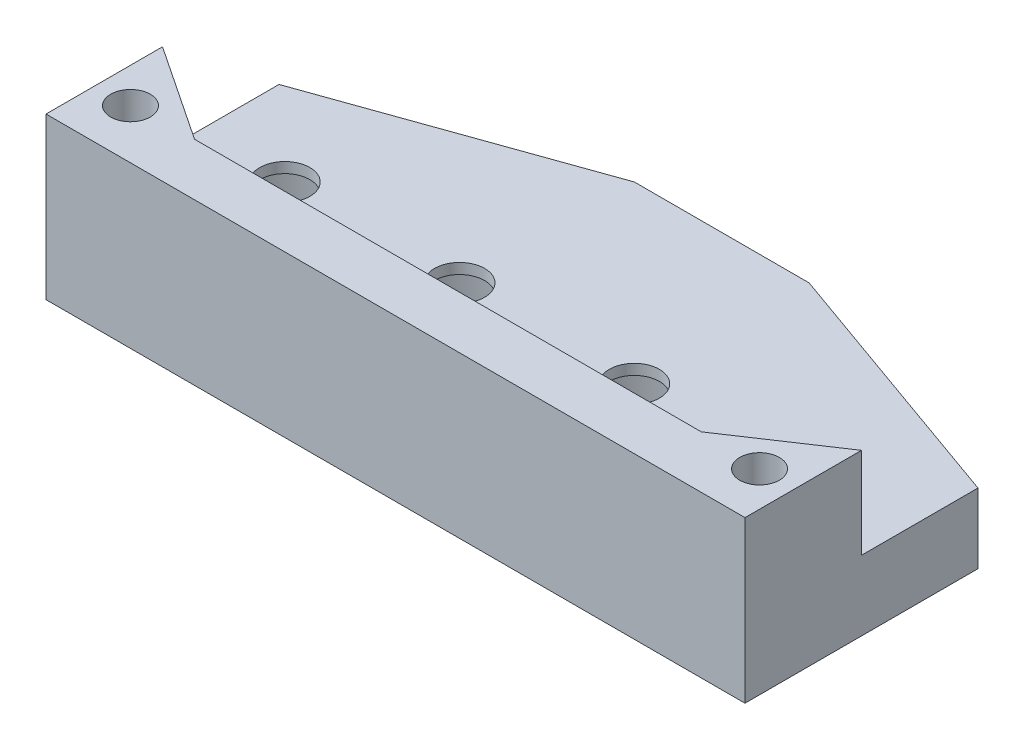
from build123d import *

# Parameters (mm, degrees)
SKETCH2_R           = 2.15
BOSS_EXTRUDE1_DEPTH = 6
BOSS_EXTRUDE2_DEPTH = 7.8
SKETCH4_R           = 1.7
CUT_EXTRUDE1_DEPTH  = 68.634606527
SKETCH5_R           = 6.55
CUT_EXTRUDE2_DEPTH  = 5.1


with BuildPart() as part:
    # Sketch2 → Boss-Extrude1 (new body)
    with BuildSketch(Plane(origin=(0, 0, 0), x_dir=(1, 0, 0), z_dir=(0, 1, 0))):
        Polygon((0, 0), (0, 20), (22.5, 28), (37.5, 28), (60, 20), (60, 0), align=None)
        with Locations((7.5, 13)):
            Circle(SKETCH2_R, mode=Mode.SUBTRACT)
        with Locations((22.5, 13)):
            Circle(SKETCH2_R, mode=Mode.SUBTRACT)
        with Locations((37.5, 13)):
            Circle(SKETCH2_R, mode=Mode.SUBTRACT)
        with Locations((52.5, 13)):
            Circle(SKETCH2_R, mode=Mode.SUBTRACT)
    extrude(amount=BOSS_EXTRUDE1_DEPTH)

    # Sketch3 → Boss-Extrude2 (add)
    with BuildSketch(Plane(origin=(0, 6, 0), x_dir=(1, 0, 0), z_dir=(0, 1, 0))):
        Polygon((0, 10), (0, 0), (60, 0), (60, 10), (51.75, 4.5), (8.25, 4.5), align=None)
    extrude(amount=BOSS_EXTRUDE2_DEPTH)

    # Sketch4 → Cut-Extrude1 (cut, through all)
    with BuildSketch(Plane(origin=(0, 13.8, 0), x_dir=(1, 0, 0), z_dir=(0, 1, 0))):
        with Locations((3, 4.25)):
            Circle(SKETCH4_R)
        with Locations((57, 4.25)):
            Circle(SKETCH4_R)
    extrude(amount=-CUT_EXTRUDE1_DEPTH, mode=Mode.SUBTRACT)

    # Sketch5 → Cut-Extrude2 (cut)
    with BuildSketch(Plane(origin=(0, 0, 0), x_dir=(1, 0, 0), z_dir=(0, 1, 0))):
        with Locations((7.5, 13)):
            Circle(SKETCH5_R)
        with Locations((22.5, 13)):
            Circle(SKETCH5_R)
        with Locations((37.5, 13)):
            Circle(SKETCH5_R)
        with Locations((52.5, 13)):
            Circle(SKETCH5_R)
    extrude(amount=CUT_EXTRUDE2_DEPTH, mode=Mode.SUBTRACT)


solid = part.part
